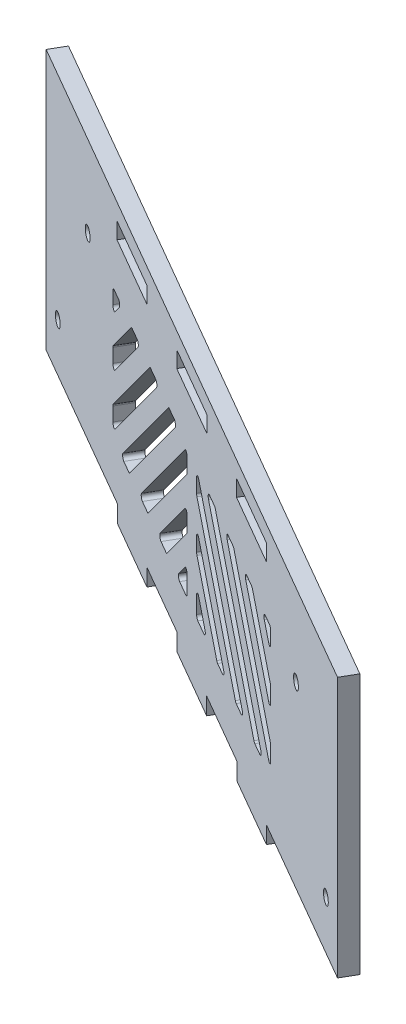
from build123d import *

# Parameters (mm, degrees)
STOCK_ACRYLIC_BAY_WALL_MASTER_1_START     = 163.456714755
STOCK_ACRYLIC_BAY_WALL_MASTER_1_OUTLINE_R = 2
STOCK_ACRYLIC_BAY_WALL_MASTER_1_DEPTH     = 5
SKETCH1_W                                 = 243.769145362
SKETCH1_H                                 = 5
BOSS_EXTRUDE1_DEPTH                       = 5
SKETCH2_W                                 = 25.2
SKETCH2_H                                 = 5
CUT_EXTRUDE1_DEPTH                        = 158.991773268
CUT_EXTRUDE2_DEPTH                        = 158.991773268
FILLET1_R                                 = 1


# Read off the part's stored shape, not the designer's step: Stock-acrylic-bay-wall-master-1
with BuildPart() as part:
    # Stock-acrylic-bay-wall-master-1 outline → Stock-acrylic-bay-wall-master-1 (new body)
    with BuildSketch(Plane(origin=(0, 0, 0), x_dir=(0.866025403784438, 0, 0.500000000000001), z_dir=(0.500000000000001, 0, -0.866025403784438)).offset(STOCK_ACRYLIC_BAY_WALL_MASTER_1_START)):
        Polygon((-121.884572681, 15), (121.884572681, 15), (121.884572681, 89.75), (62.4, 89.75), (62.4, 95), (37.6, 95), (37.6, 89.75), (12.4, 89.75), (12.4, 95), (-12.4, 95), (-12.4, 89.75), (-37.6, 89.75), (-37.6, 95), (-62.4, 95), (-62.4, 89.75), (-121.884572681, 89.75), align=None)
        with Locations((-87.134572681, 35)):
            Circle(STOCK_ACRYLIC_BAY_WALL_MASTER_1_OUTLINE_R, mode=Mode.SUBTRACT)
        with Locations((87.134572681, 35)):
            Circle(STOCK_ACRYLIC_BAY_WALL_MASTER_1_OUTLINE_R, mode=Mode.SUBTRACT)
        with Locations((-112.134572681, 75)):
            Circle(STOCK_ACRYLIC_BAY_WALL_MASTER_1_OUTLINE_R, mode=Mode.SUBTRACT)
        with Locations((112.134572681, 75)):
            Circle(STOCK_ACRYLIC_BAY_WALL_MASTER_1_OUTLINE_R, mode=Mode.SUBTRACT)
    extrude(amount=STOCK_ACRYLIC_BAY_WALL_MASTER_1_DEPTH)

    # Sketch1 → Boss-Extrude1 (add)
    with BuildSketch(Plane(origin=(81.728357378, 0, -141.557667397), x_dir=(0.8660254037844384, 0, 0.5000000000000007), z_dir=(-0.5000000000000007, 0, 0.8660254037844384))):
        with Locations((0, -12.5)):
            Rectangle(SKETCH1_W, SKETCH1_H)
    extrude(amount=-BOSS_EXTRUDE1_DEPTH)

    # Sketch2 → Cut-Extrude1 (cut, through all)
    with BuildSketch(Plane(origin=(81.728357378, 0, -141.557667397), x_dir=(0.8660254037844384, 0, 0.5000000000000007), z_dir=(-0.5000000000000007, 0, 0.8660254037844384))):
        with Locations((0, -17.5)):
            Rectangle(SKETCH2_W, SKETCH2_H)
        with Locations((50, -17.5)):
            Rectangle(SKETCH2_W, SKETCH2_H)
        with Locations((-50, -17.5)):
            Rectangle(SKETCH2_W, SKETCH2_H)
    extrude(amount=-CUT_EXTRUDE1_DEPTH, mode=Mode.SUBTRACT)

    # Sketch3 → Cut-Extrude2 (cut, through all)
    with BuildSketch(Plane(origin=(81.728357378, 0, -141.557667397), x_dir=(0.8660254037844384, 0, 0.5000000000000007), z_dir=(-0.5000000000000007, 0, 0.8660254037844384))):
        Polygon((-66, -41.946067812), (-58.928932188, -34.875), (-66, -34.875), align=None)
        Polygon((-66, -50.431349186), (-50.443650814, -34.875), (-43.372583002, -34.875), (-66, -57.502416998), align=None)
        Polygon((-12.661904883, -74.875), (-4, -66.213095117), (-4, -74.875), align=None)
        Polygon((-66, -65.987698372), (-34.887301628, -34.875), (-27.816233816, -34.875), (-66, -73.058766184), align=None)
        Polygon((-59.330952442, -74.875), (-19.330952442, -34.875), (-12.25988463, -34.875), (-52.25988463, -74.875), align=None)
        Polygon((-4, -42.171464556), (-36.703535444, -74.875), (-43.774603256, -74.875), (-4, -35.100396744), align=None)
        Polygon((-28.218254069, -74.875), (-4, -50.656745931), (-4, -57.727813742), (-21.147186258, -74.875), align=None)
        Polygon((4, -74.875), (12.661904883, -74.875), (4, -66.213095117), align=None)
        Polygon((21.147186258, -74.875), (28.218254069, -74.875), (4, -50.656745931), (4, -57.727813742), align=None)
        Polygon((4, -42.171464556), (4, -35.100396744), (43.774603256, -74.875), (36.703535444, -74.875), align=None)
        Polygon((52.25988463, -74.875), (59.330952442, -74.875), (19.330952442, -34.875), (12.25988463, -34.875), align=None)
        Polygon((27.816233816, -34.875), (34.887301628, -34.875), (66, -65.987698372), (66, -73.058766184), align=None)
        Polygon((50.443650814, -34.875), (43.372583002, -34.875), (66, -57.502416998), (66, -50.431349186), align=None)
        Polygon((66, -34.875), (58.928932188, -34.875), (66, -41.946067812), align=None)
    extrude(amount=-CUT_EXTRUDE2_DEPTH, mode=Mode.SUBTRACT)

    # Fillet1
    fillet1_edges = [part.edges().sort_by_distance(p)[0] for p in [
        (25.820680728, -34.875, -176.722730907),
        (31.944405085, -34.875, -173.187197001),
        (25.820680728, -41.946067812, -176.722730907),
        (79.514255762, -74.875, -145.722730907),
        (72.012826088, -74.875, -150.053683348),
        (79.514255762, -66.213095117, -145.722730907),
        (25.820680728, -57.502416998, -176.722730907),
        (25.820680728, -50.431349186, -176.722730907),
        (39.292874313, -34.875, -168.944556314),
        (45.41659867, -34.875, -165.409022408),
        (25.820680728, -73.058766184, -176.722730907),
        (25.820680728, -65.987698372, -176.722730907),
        (52.765067898, -34.875, -161.166381721),
        (58.888792255, -34.875, -157.630847815),
        (37.719969689, -74.875, -169.852673222),
        (31.596245332, -74.875, -173.388207127),
        (66.237261484, -34.875, -153.388207127),
        (72.360985841, -34.875, -149.852673222),
        (79.514255762, -35.100396744, -145.722730907),
        (79.514255762, -42.171464556, -145.722730907),
        (51.192163275, -74.875, -162.074498628),
        (45.068438918, -74.875, -165.610032534),
        (58.540632503, -74.875, -157.831857941),
        (79.514255762, -50.656745931, -145.722730907),
        (79.514255762, -57.727813742, -145.722730907),
        (86.442458993, -74.875, -141.722730907),
        (86.442458993, -66.213095117, -141.722730907),
        (93.943888667, -74.875, -137.391778465),
        (140.136034027, -34.875, -110.722730907),
        (140.136034027, -41.946067812, -110.722730907),
        (134.01230967, -34.875, -114.258264813),
        (101.292357895, -74.875, -133.149137778),
        (86.442458993, -57.727813742, -141.722730907),
        (86.442458993, -50.656745931, -141.722730907),
        (107.416082252, -74.875, -129.613603872),
        (114.764551481, -74.875, -125.370963185),
        (86.442458993, -42.171464556, -141.722730907),
        (86.442458993, -35.100396744, -141.722730907),
        (120.888275838, -74.875, -121.835429279),
        (128.236745066, -74.875, -117.592788592),
        (93.595728915, -34.875, -137.592788592),
        (99.719453271, -34.875, -134.057254686),
        (134.360469423, -74.875, -114.057254686),
        (140.136034027, -73.058766184, -110.722730907),
        (107.0679225, -34.875, -129.814613999),
        (113.191646857, -34.875, -126.279080093),
        (140.136034027, -65.987698372, -110.722730907),
        (126.663840442, -34.875, -118.5009055),
        (140.136034027, -50.431349186, -110.722730907),
        (140.136034027, -57.502416998, -110.722730907),
        (120.540116085, -34.875, -122.036439406),
    ]]
    fillet(fillet1_edges, radius=FILLET1_R)


solid = part.part
